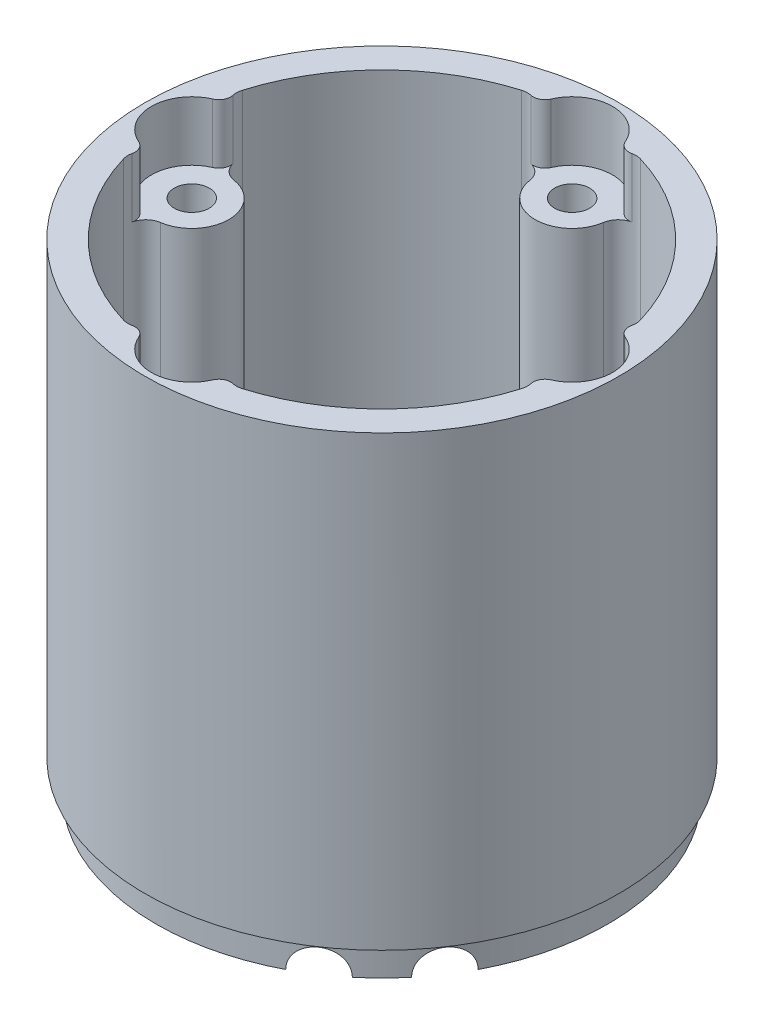
from build123d import *

# Parameters (mm, degrees)
SKETCH2_R                   = 7.9375
SKETCH2_R_2                 = 3.7465
BOSS_EXTRUDE1_DEPTH         = 204.47
FILLET1_R                   = 3.81
CIRPATTERN1_COUNT           = 4
FILLET1_OF_CIRPATTERN1_R    = 3.81
SKETCH3_R                   = 8.636
CUT_EXTRUDE1_DEPTH          = 12.7
CIRPATTERN2_COUNT           = 4
FILLET2_R                   = 2.54
MIRROR1_COPY_1_SKETCH_R     = 8.636
MIRROR1_COPY_1_DEPTH        = 12.7
MIRROR1_COPY_2_SKETCH_R     = 8.636
MIRROR1_COPY_2_DEPTH        = 12.7
MIRROR1_COPY_3_SKETCH_R     = 8.636
MIRROR1_COPY_3_DEPTH        = 12.7
FILLET3_R                   = 2.54
CHAMFER1_SIZE               = 1.27
CHAMFER1_SIZE_2             = 7.202527911
F_3_8_CLEARANCE_HOLE1_D     = 10.0838
F_3_8_CLEARANCE_HOLE1_DEPTH = 54.864
F_3_8_CLEARANCE_HOLE1_TIP   = 3.029479155
CIRPATTERN3_COUNT           = 3
CIRPATTERN3_ANGLE           = 180
CUT_EXTRUDE2_START          = -204.47
SKETCH9_R                   = 52.832
CUT_EXTRUDE2_DEPTH          = 101.788087
SKETCH10_W                  = 4.445
SKETCH10_H                  = 6.796913


with BuildPart() as part:
    # Sketch1 → Revolve1 (revolve)
    with BuildSketch(Plane.XY, mode=Mode.PRIVATE) as revolve1_sk:
        Polygon((44.45, 0), (44.45, 204.47), (50.7238, 204.47), (50.7238, 108.585), (52.832, 108.585), (52.832, 95.885), (50.7238, 95.885), (50.7238, 0), align=None)
    revolve(revolve1_sk.sketch.rotate(Axis((0, 138.931800571, 0), (0, -1, 0)), 180), axis=Axis((0, 138.931800571, 0), (0, -1, 0)))

    # Sketch2 → Boss-Extrude1 (add)
    with BuildSketch(Plane(origin=(0, 204.47, 0), x_dir=(1, 0, 0), z_dir=(0, 1, 0))):
        with Locations((0, 40.7035)):
            Circle(SKETCH2_R)
        with Locations(Location((0, 40.7035, 0), (0, 0, 180))):
            Circle(SKETCH2_R_2, mode=Mode.SUBTRACT)
    boss_extrude1 = extrude(amount=-BOSS_EXTRUDE1_DEPTH)

    # Fillet1
    fillet1_edges = [part.edges().sort_by_distance(p)[0] for p in [
        (-7.287865551, 102.235, -43.848483619),
        (7.287865551, 102.235, -43.848483619),
    ]]
    fillet(fillet1_edges, radius=FILLET1_R)

    # CirPattern1: Boss-Extrude1 ×4 about axis
    cirpattern1_axis = Axis((0, 0, 0), (0, 1, 0))
    for i in range(1, CIRPATTERN1_COUNT):
        add(boss_extrude1.rotate(cirpattern1_axis, i * 360 / CIRPATTERN1_COUNT))

    # Fillet1 of CirPattern1
    fillet1_of_cirpattern1_edges = [part.edges().sort_by_distance(p)[0] for p in [
        (-43.848483619, 102.235, 7.287865551),
        (-43.848483619, 102.235, -7.287865551),
        (7.287865551, 102.235, 43.848483619),
        (-7.287865551, 102.235, 43.848483619),
        (43.848483619, 102.235, -7.287865551),
        (43.848483619, 102.235, 7.287865551),
    ]]
    fillet(fillet1_of_cirpattern1_edges, radius=FILLET1_OF_CIRPATTERN1_R)

    # Sketch3 → Cut-Extrude1 (cut)
    with BuildSketch(Plane(origin=(0, 204.47, 0), x_dir=(1, 0, 0), z_dir=(0, 1, 0))):
        with Locations((0, 40.7035)):
            Circle(SKETCH3_R)
    cut_extrude1 = extrude(amount=-CUT_EXTRUDE1_DEPTH, mode=Mode.SUBTRACT)

    # CirPattern2: Cut-Extrude1 ×4 about axis
    cirpattern2_axis = Axis((0, 0, 0), (0, 1, 0))
    for i in range(1, CIRPATTERN2_COUNT):
        add(cut_extrude1.rotate(cirpattern2_axis, i * 360 / CIRPATTERN2_COUNT), mode=Mode.SUBTRACT)

    # Fillet2
    fillet2_edges = [part.edges().sort_by_distance(p)[0] for p in [
        (-8.61576795, 198.12, -41.294294914),
        (8.61576795, 198.12, -41.294294914),
        (-41.294294914, 198.12, 8.61576795),
        (8.61576795, 198.12, 41.294294914),
        (41.294294914, 198.12, -8.61576795),
        (41.294294914, 198.12, 8.61576795),
        (-8.61576795, 198.12, 41.294294914),
        (-41.294294914, 198.12, -8.61576795),
    ]]
    fillet(fillet2_edges, radius=FILLET2_R)

    # Mirror1: Cut-Extrude1 across plane
    add(cut_extrude1.mirror(Plane.ZX.offset(102.235)), mode=Mode.SUBTRACT)

    # Mirror1 copy 1 sketch → Mirror1 copy 1 (cut)
    with BuildSketch(Plane(origin=(0, 0, 0), x_dir=(0, 0, -1), z_dir=(0, -1, 0))):
        with Locations((0, -40.7035)):
            Circle(MIRROR1_COPY_1_SKETCH_R)
    extrude(amount=-MIRROR1_COPY_1_DEPTH, mode=Mode.SUBTRACT)

    # Mirror1 copy 2 sketch → Mirror1 copy 2 (cut)
    with BuildSketch(Plane(origin=(0, 0, 0), x_dir=(-1, 0, 0), z_dir=(0, -1, 0))):
        with Locations((0, -40.7035)):
            Circle(MIRROR1_COPY_2_SKETCH_R)
    extrude(amount=-MIRROR1_COPY_2_DEPTH, mode=Mode.SUBTRACT)

    # Mirror1 copy 3 sketch → Mirror1 copy 3 (cut)
    with BuildSketch(Plane(origin=(0, 0, 0), x_dir=(0, 0, 1), z_dir=(0, -1, 0))):
        with Locations((0, -40.7035)):
            Circle(MIRROR1_COPY_3_SKETCH_R)
    extrude(amount=-MIRROR1_COPY_3_DEPTH, mode=Mode.SUBTRACT)

    # Fillet3
    fillet3_edges = [part.edges().sort_by_distance(p)[0] for p in [
        (-41.294294914, 6.35, 8.61576795),
        (8.61576795, 6.35, 41.294294914),
        (41.294294914, 6.35, -8.61576795),
        (-8.61576795, 6.35, -41.294294914),
        (8.61576795, 6.35, -41.294294914),
        (41.294294914, 6.35, 8.61576795),
        (-8.61576795, 6.35, 41.294294914),
        (-41.294294914, 6.35, -8.61576795),
    ]]
    fillet(fillet3_edges, radius=FILLET3_R)

    # Chamfer1
    # the kernel refuses this chamfer: 7.202527911, 1.27 mm, written as the material it adds along each edge
    with BuildSketch(Plane(origin=(0, 95.885, 0), x_dir=(-1, 0, 0), z_dir=(0, 0, 1))) as chamfer1_piece_1_section:
        Polygon((50.7238, CHAMFER1_SIZE), (50.7238 + CHAMFER1_SIZE_2, 0), (50.7238, 0), align=None)
    chamfer1_piece_1 = revolve(axis=Axis((0, 95.885, 0), (0, -1, 0)), mode=Mode.PRIVATE)
    chamfer1_piece_1 = chamfer1_piece_1 & Plane(origin=(0, 94.871613174, 0), x_dir=(-1, 0, 0), z_dir=(0, -1, 0)) * Cylinder(52.832, 232, mode=Mode.PRIVATE)
    add(chamfer1_piece_1)

    # 3/8 Clearance Hole1
    with Locations(Plane(origin=(37.357865464, 0, 37.357865464), x_dir=(0, 1, 0), z_dir=(0.7071067811865488, 0, 0.7071067811865464))):
        with Locations((101.78586627, -9.525), (101.78586627, 9.525)):
            Hole(F_3_8_CLEARANCE_HOLE1_D / 2, depth=F_3_8_CLEARANCE_HOLE1_DEPTH)
            with Locations((0, 0, -(F_3_8_CLEARANCE_HOLE1_DEPTH + F_3_8_CLEARANCE_HOLE1_TIP / 2))):  # 118° drill point
                Cone(0, F_3_8_CLEARANCE_HOLE1_D / 2, F_3_8_CLEARANCE_HOLE1_TIP, mode=Mode.SUBTRACT)

    # Sketch8 → #6 Clearance Hole1 (revolve, cut)
    with BuildSketch(Plane(origin=(37.357865464, 101.78586627, -37.357865464), x_dir=(-0.7071067811865512, 0, -0.7071067811865438), z_dir=(0, 1, 0))):
        Polygon((0, 0), (0, 56.004824014), (1.89865, 54.864), (1.89865, 0), align=None)
    f_6_clearance_hole1 = revolve(axis=Axis((41.847993524, 101.78586627, -41.847993524), (-0.7071067811865438, 0, 0.7071067811865512)), mode=Mode.SUBTRACT)

    # CirPattern3: #6 Clearance Hole1 ×3 about axis
    cirpattern3_axis = Axis((0, 138.931800571, 0), (0, 1, 0))
    for i in range(1, CIRPATTERN3_COUNT):
        add(f_6_clearance_hole1.rotate(cirpattern3_axis, i * CIRPATTERN3_ANGLE / (CIRPATTERN3_COUNT - 1)), mode=Mode.SUBTRACT)

    # Sketch9 → Cut-Extrude2 (cut)
    with BuildSketch(Plane(origin=(0, 204.47, 0), x_dir=(1, 0, 0), z_dir=(0, 1, 0)).offset(CUT_EXTRUDE2_START)):
        with Locations(Location((0, 0, 0), (0, 0, 180))):
            Circle(SKETCH9_R)
    extrude(amount=CUT_EXTRUDE2_DEPTH, mode=Mode.SUBTRACT)

    # Sketch10 → Cut-Revolve1 (revolve, cut)
    with BuildSketch(Plane.XY, mode=Mode.PRIVATE) as cut_revolve1_sk:
        with Locations((50.6095, 105.1865435)):
            Rectangle(SKETCH10_W, SKETCH10_H)
    revolve(cut_revolve1_sk.sketch.rotate(Axis((0, 204.47, 0), (0, -1, 0)), 90), axis=Axis((0, 204.47, 0), (0, -1, 0)), mode=Mode.SUBTRACT)


solid = part.part
